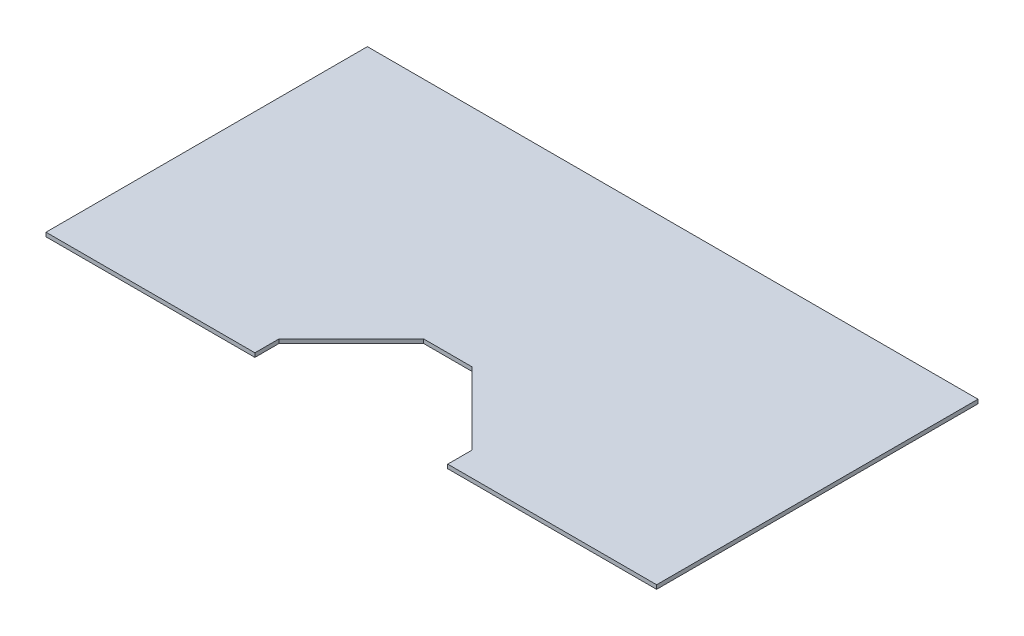
from build123d import *

# Parameters (mm, degrees)
BOSS_EXTRUDE1_DEPTH = 3.175
CHAMFER1_SIZE       = 57.15


with BuildPart() as part:
    # Sketch1 → Boss-Extrude1 (new body)
    with BuildSketch(Plane(origin=(0, 0, 0), x_dir=(1, 0, 0), z_dir=(0, 1, 0))):
        Polygon((165.1, 0), (165.1, 76.2), (317.5, 76.2), (317.5, 0), (482.6, 0), (482.6, 254), (0, 254), (0, 0), align=None)
    extrude(amount=BOSS_EXTRUDE1_DEPTH)

    # Chamfer1
    chamfer1_edges = [part.edges().sort_by_distance(p)[0] for p in [
        (317.5, 1.5875, -76.2),
        (165.1, 1.5875, -76.2),
    ]]
    chamfer(chamfer1_edges, length=CHAMFER1_SIZE)


solid = part.part
